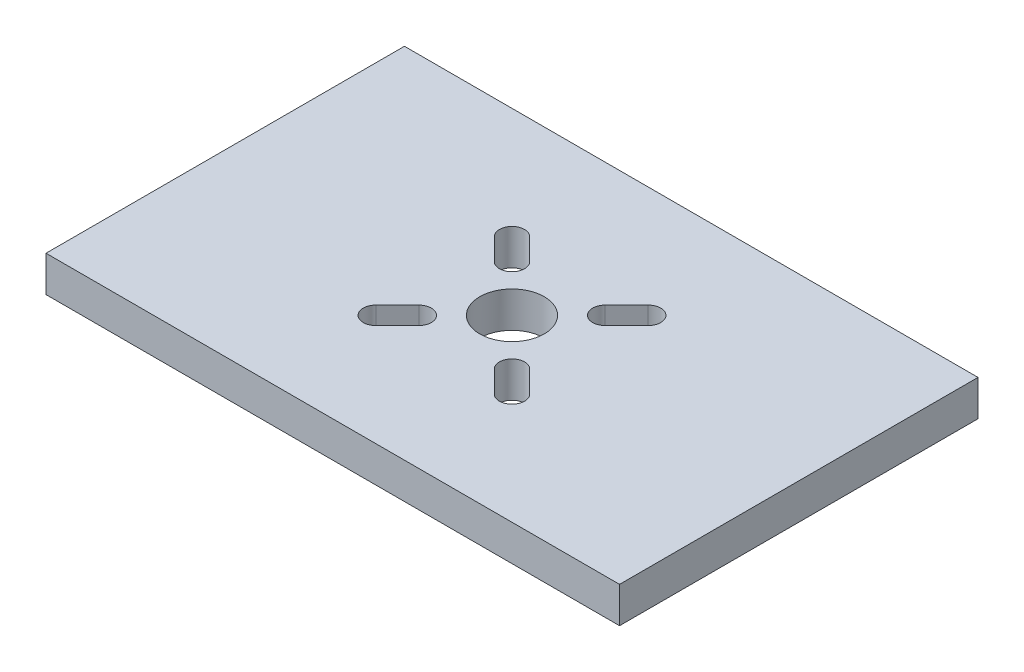
from build123d import *

# Parameters (mm, degrees)
SKETCH1_W          = 160
SKETCH1_H          = 100
BASE_DEPTH         = 10
SKETCH2_R          = 9
ACTUATOR_CUT_DEPTH = 40
CUT_EXTRUDE1_REACH = 96.868


with BuildPart() as part:
    # Sketch1 → base (new body)
    with BuildSketch(Plane(origin=(0, 0, 0), x_dir=(1, 0, 0), z_dir=(0, 1, 0))):
        Rectangle(SKETCH1_W, SKETCH1_H)
    extrude(amount=BASE_DEPTH)

    # Sketch2 → actuator cut (cut)
    with BuildSketch(Plane(origin=(0, 10, 0), x_dir=(1, 0, 0), z_dir=(0, 1, 0))):
        Circle(SKETCH2_R)
    extrude(amount=-ACTUATOR_CUT_DEPTH, mode=Mode.SUBTRACT)

    # Sketch3 → Cut-Extrude1 (cut, up to next)
    with BuildSketch(Plane(origin=(0, 10, 0), x_dir=(1, 0, 0), z_dir=(0, 1, 0)), mode=Mode.PRIVATE) as cut_extrude1_sk1:
        with BuildLine():
            Line((-21.474873734, -16.525126266), (-15.474873734, -10.525126266))
            ThreePointArc((-15.474873734, -10.525126266), (-10.525126266, -10.525126266), (-10.525126266, -15.474873734))
            Line((-10.525126266, -15.474873734), (-16.525126266, -21.474873734))
            ThreePointArc((-16.525126266, -21.474873734), (-21.474873734, -21.474873734), (-21.474873734, -16.525126266))
        make_face()
    cut_extrude1_tool1 = extrude(cut_extrude1_sk1.sketch, amount=-CUT_EXTRUDE1_REACH, mode=Mode.PRIVATE) & part.part
    # Sketch3 → Cut-Extrude1 (cut, up to next)
    with BuildSketch(Plane(origin=(0, 10, 0), x_dir=(1, 0, 0), z_dir=(0, 1, 0)), mode=Mode.PRIVATE) as cut_extrude1_sk2:
        with BuildLine():
            Line((21.474873734, -16.525126266), (15.474873734, -10.525126266))
            ThreePointArc((15.474873734, -10.525126266), (10.525126266, -10.525126266), (10.525126266, -15.474873734))
            Line((10.525126266, -15.474873734), (16.525126266, -21.474873734))
            ThreePointArc((16.525126266, -21.474873734), (21.474873734, -21.474873734), (21.474873734, -16.525126266))
        make_face()
    cut_extrude1_tool2 = extrude(cut_extrude1_sk2.sketch, amount=-CUT_EXTRUDE1_REACH, mode=Mode.PRIVATE) & part.part
    # Sketch3 → Cut-Extrude1 (cut, up to next)
    with BuildSketch(Plane(origin=(0, 10, 0), x_dir=(1, 0, 0), z_dir=(0, 1, 0)), mode=Mode.PRIVATE) as cut_extrude1_sk3:
        with BuildLine():
            Line((21.474873734, 16.525126266), (15.474873734, 10.525126266))
            ThreePointArc((15.474873734, 10.525126266), (10.525126266, 10.525126266), (10.525126266, 15.474873734))
            Line((10.525126266, 15.474873734), (16.525126266, 21.474873734))
            ThreePointArc((16.525126266, 21.474873734), (21.474873734, 21.474873734), (21.474873734, 16.525126266))
        make_face()
    cut_extrude1_tool3 = extrude(cut_extrude1_sk3.sketch, amount=-CUT_EXTRUDE1_REACH, mode=Mode.PRIVATE) & part.part
    # Sketch3 → Cut-Extrude1 (cut, up to next)
    with BuildSketch(Plane(origin=(0, 10, 0), x_dir=(1, 0, 0), z_dir=(0, 1, 0)), mode=Mode.PRIVATE) as cut_extrude1_sk4:
        with BuildLine():
            Line((-21.474873734, 16.525126266), (-15.474873734, 10.525126266))
            ThreePointArc((-15.474873734, 10.525126266), (-10.525126266, 10.525126266), (-10.525126266, 15.474873734))
            Line((-10.525126266, 15.474873734), (-16.525126266, 21.474873734))
            ThreePointArc((-16.525126266, 21.474873734), (-21.474873734, 21.474873734), (-21.474873734, 16.525126266))
        make_face()
    cut_extrude1_tool4 = extrude(cut_extrude1_sk4.sketch, amount=-CUT_EXTRUDE1_REACH, mode=Mode.PRIVATE) & part.part
    add(cut_extrude1_tool1.solids().sort_by_distance((-16, 10, 16))[0], mode=Mode.SUBTRACT)
    add(cut_extrude1_tool2.solids().sort_by_distance((16, 10, 16))[0], mode=Mode.SUBTRACT)
    add(cut_extrude1_tool3.solids().sort_by_distance((16, 10, -16))[0], mode=Mode.SUBTRACT)
    add(cut_extrude1_tool4.solids().sort_by_distance((-16, 10, -16))[0], mode=Mode.SUBTRACT)


solid = part.part
